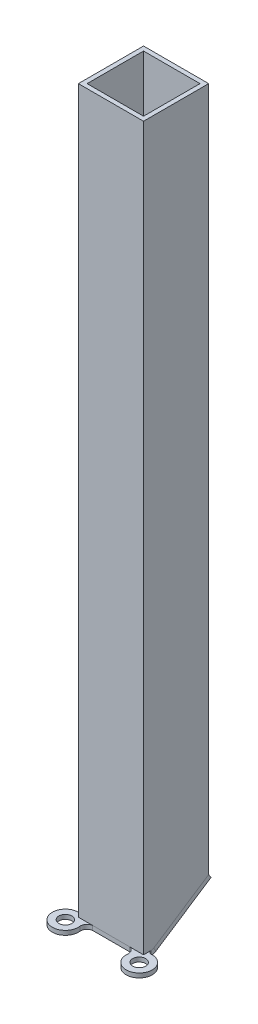
from build123d import *

# Parameters (mm, degrees)
SZKIC1_W                               = 30
SZKIC1_H                               = 30
SZKIC1_W_2                             = 26
SZKIC1_H_2                             = 26
PUTM_F_SQUARE_PROFILES_30X30X2_1_DEPTH = 332.439810961
WYTNIJ_WYCI_GNI_CIE2_DEPTH             = 548.739128832
WYCI_GNI_CIE_CIENKA_CIANKA1_DEPTH      = 30
KONWERTUJ_START                        = 1005
KONWERTUJ_BRY_1_DEPTH                  = 30
KONWERTUJ_BRY_1_2_DEPTH                = 30
SZKIC10_R                              = 3
DODANIE_WYCI_GNI_CIE3_DEPTH            = 2


# Read off the part's stored shape, not the designer's step: Konwertuj bryłę1
with BuildPart() as part:
    # Szkic1 → Putm-f-square-profiles 30X30X2(1) (new body)
    with BuildSketch(Plane(origin=(1020, 0, 419.283231707), x_dir=(1, 0, 0), z_dir=(0, -1, 0))):
        Rectangle(SZKIC1_W, SZKIC1_H)
        Rectangle(SZKIC1_W_2, SZKIC1_H_2, mode=Mode.SUBTRACT)
    extrude(amount=PUTM_F_SQUARE_PROFILES_30X30X2_1_DEPTH)

    # Szkic4 → Wytnij-wyciągnięcie2 (cut, through all)
    with BuildSketch(Plane(origin=(1035, 0, 0), x_dir=(0, 0, -1), z_dir=(1, 0, 0))):
        Polygon((-430.113764924, -332.439810961), (-404.283231707, -315.439810961), (-404.283231707, -332.439810961), align=None)
    extrude(amount=-WYTNIJ_WYCI_GNI_CIE2_DEPTH, mode=Mode.SUBTRACT)


with BuildPart() as body_2:
    # Szkic5 → Wyciągnięcie-cienka ścianka1 (new, through all)
    with BuildSketch(Plane(origin=(1035, 0, 0), x_dir=(0, 0, -1), z_dir=(1, 0, 0))):
        Polygon((-434.283231707, -332.439810961), (-430.113764924, -332.439810961), (-404.283231707, -315.439810961), (-403.183717583, -317.110460144), (-429.514680638, -334.439810961), (-434.283231707, -334.439810961), align=None)
    extrude(amount=-WYCI_GNI_CIE_CIENKA_CIANKA1_DEPTH)

    # Konwertuj bryłę1 outline → Konwertuj bryłę1 (cut)
    with BuildSketch(Plane.YZ.offset(KONWERTUJ_START)):
        with BuildLine():
            ThreePointArc((-333.781109326, 428.513820963), (-334.271598629, 429.56506732), (-334.439810961, 430.712849211))
            Line((-334.439810961, 430.712849211), (-334.439810961, 429.514680638))
            Line((-334.439810961, 429.514680638), (-333.781109326, 428.513820963))
        make_face()
    extrude(amount=KONWERTUJ_BRY_1_DEPTH, mode=Mode.SUBTRACT)

    # Konwertuj bry_1 2 outline → Konwertuj bry_1 2 (add)
    with BuildSketch(Plane.YZ.offset(KONWERTUJ_START)):
        with BuildLine():
            ThreePointArc((-332.110460144, 429.613335087), (-332.355704795, 430.138958265), (-332.439810961, 430.712849211))
            Line((-332.439810961, 430.712849211), (-332.439810961, 430.113764924))
            Line((-332.439810961, 430.113764924), (-332.110460144, 429.613335087))
        make_face()
    extrude(amount=KONWERTUJ_BRY_1_2_DEPTH)

    # Szkic10 → Dodanie-wyciągnięcie3 (add)
    # profile 1 of 2: a face of its own
    with BuildSketch(Plane.XZ.offset(334.439810961)):
        with BuildLine():
            ThreePointArc((1031.039616452, 437.59488008), (1030.440005619, 435.425099056), (1028.5, 434.283231707))
            Line((1028.5, 434.283231707), (1035, 434.283231707))
            Line((1035, 434.283231707), (1035, 430.799916934))
            ThreePointArc((1035, 430.799916934), (1035.475304923, 431.895362049), (1036.6, 432.296579888))
            ThreePointArc((1036.6, 432.296579888), (1041.13903563, 442.62700703), (1031.039616452, 437.59488008))
        make_face()
        with Locations(Location((1037, 438.283231707, 0), (0, 0, 270))):
            Circle(SZKIC10_R, mode=Mode.SUBTRACT)
    # profile 2 of 2: a face of its own
    with BuildSketch(Plane.XZ.offset(334.439810961)):
        with BuildLine():
            Line((1005, 430.799916934), (1005, 434.283231707))
            Line((1005, 434.283231707), (1011.5, 434.283231707))
            ThreePointArc((1011.5, 434.283231707), (1009.559994381, 435.425099056), (1008.960383548, 437.59488008))
            ThreePointArc((1008.960383548, 437.59488008), (998.86096437, 442.62700703), (1003.4, 432.296579888))
            ThreePointArc((1003.4, 432.296579888), (1004.524695077, 431.895362049), (1005, 430.799916934))
        make_face()
        with Locations(Location((1003, 438.283231707, 0), (0, 0, 270))):
            Circle(SZKIC10_R, mode=Mode.SUBTRACT)
    extrude(amount=-DODANIE_WYCI_GNI_CIE3_DEPTH)


solid = Compound([part.part, body_2.part])
